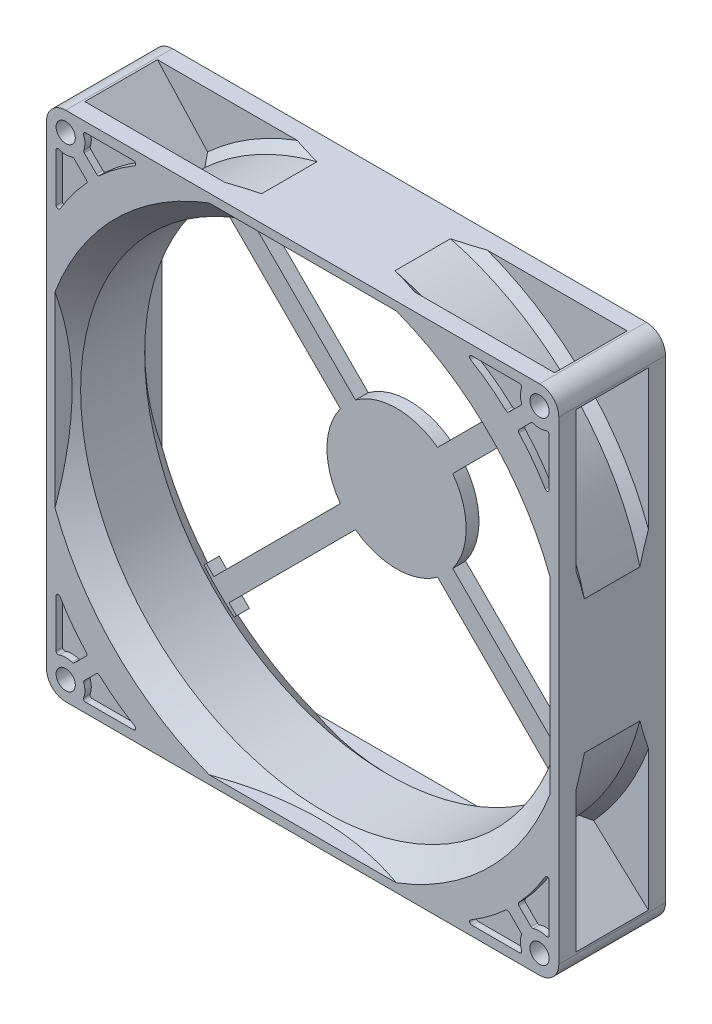
from build123d import *

# Parameters (mm, degrees)
SKETCH1_R                    = 2.25
BOSS_EXTRUDE1_DEPTH          = 12.5
CUT_EXTRUDE1_DEPTH           = 1.5
SPLIT1_SURFACE_1_BACK        = 172.537
SPLIT1_SURFACE_1_DEPTH       = 345.074
SPLIT1_SURFACE_2_BACK        = 172.537
SPLIT1_SURFACE_2_DEPTH       = 345.074
SKETCH6_R                    = 57
CUT_EXTRUDE2_DEPTH           = 25
CHAMFER1_SIZE                = 5
SKETCH7_R                    = 3.4
CUT_EXTRUDE3_DEPTH           = 2.5
BOSS_EXTRUDE2_DEPTH          = 3
CUT_EXTRUDE4_DEPTH           = 8.5
CHAMFER2_SIZE                = 2
CIRPATTERN1_COUNT            = 4
CHAMFER2_OF_CIRPATTERN1_SIZE = 2


with BuildPart() as part:
    # Sketch1 → Boss-Extrude1 (new, symmetric)
    with BuildSketch(Plane.XY):
        with BuildLine():
            Line((-55.5, -60), (55.5, -60))
            ThreePointArc((55.5, -60), (58.681980515, -58.681980515), (60, -55.5))
            Line((60, -55.5), (60, 55.5))
            ThreePointArc((60, 55.5), (58.681980515, 58.681980515), (55.5, 60))
            Line((55.5, 60), (-55.5, 60))
            ThreePointArc((-55.5, 60), (-58.681980515, 58.681980515), (-60, 55.5))
            Line((-60, 55.5), (-60, -55.5))
            ThreePointArc((-60, -55.5), (-58.681980515, -58.681980515), (-55.5, -60))
        make_face()
        with Locations((-55.5, 55.5)):
            Circle(SKETCH1_R, mode=Mode.SUBTRACT)
        with Locations((-55.5, -55.5)):
            Circle(SKETCH1_R, mode=Mode.SUBTRACT)
        with Locations((55.5, -55.5)):
            Circle(SKETCH1_R, mode=Mode.SUBTRACT)
        with Locations((55.5, 55.5)):
            Circle(SKETCH1_R, mode=Mode.SUBTRACT)
    extrude(amount=BOSS_EXTRUDE1_DEPTH, both=True)

    # Sketch3 → Cut-Extrude1 (cut)
    with BuildSketch(Plane.XY.offset(12.5)):
        with BuildLine():
            Line((-39.602885683, -57.75), (-50.816251501, -57.75))
            ThreePointArc((-50.816251501, -57.75), (-51.227043419, -57.535043856), (-51.284626351, -57.075))
            ThreePointArc((-51.284626351, -57.075), (-51.000273088, -55.549575377), (-51.250948923, -54.018256113))
            ThreePointArc((-51.250948923, -54.018256113), (-51.266226764, -53.742054123), (-51.132321003, -53.5))
            Line((-51.132321003, -53.5), (-48.302670537, -50.671382096))
            ThreePointArc((-48.302670537, -50.671382096), (-47.958934821, -50.525095133), (-47.609754736, -50.657863302))
            ThreePointArc((-47.609754736, -50.657863302), (-43.641231653, -53.95676143), (-39.347764767, -56.819984514))
            ThreePointArc((-39.347764767, -56.819984514), (-39.12069913, -57.382272932), (-39.602885683, -57.75))
        make_face()
        with BuildLine():
            Line((-48.302670537, 50.671382096), (-51.132321003, 53.5))
            ThreePointArc((-51.132321003, 53.5), (-51.266226764, 53.742054123), (-51.250948923, 54.018256113))
            ThreePointArc((-51.250948923, 54.018256113), (-51.000273088, 55.549575377), (-51.284626351, 57.075))
            ThreePointArc((-51.284626351, 57.075), (-51.227043419, 57.535043856), (-50.816251501, 57.75))
            Line((-50.816251501, 57.75), (-39.602885683, 57.75))
            ThreePointArc((-39.602885683, 57.75), (-39.12069913, 57.382272932), (-39.347764767, 56.819984514))
            ThreePointArc((-39.347764767, 56.819984514), (-43.641231653, 53.95676143), (-47.609754736, 50.657863302))
            ThreePointArc((-47.609754736, 50.657863302), (-47.958934821, 50.525095133), (-48.302670537, 50.671382096))
        make_face()
        with BuildLine():
            Line((39.602885683, 57.75), (50.816251501, 57.75))
            ThreePointArc((50.816251501, 57.75), (51.227043419, 57.535043856), (51.284626351, 57.075))
            ThreePointArc((51.284626351, 57.075), (51.000273088, 55.549575377), (51.250948923, 54.018256113))
            ThreePointArc((51.250948923, 54.018256113), (51.266226764, 53.742054123), (51.132321003, 53.5))
            Line((51.132321003, 53.5), (48.302670537, 50.671382096))
            ThreePointArc((48.302670537, 50.671382096), (47.958934821, 50.525095133), (47.609754736, 50.657863302))
            ThreePointArc((47.609754736, 50.657863302), (43.641231653, 53.95676143), (39.347764767, 56.819984514))
            ThreePointArc((39.347764767, 56.819984514), (39.12069913, 57.382272932), (39.602885683, 57.75))
        make_face()
        with BuildLine():
            Line((48.302670537, -50.671382096), (51.132321003, -53.5))
            ThreePointArc((51.132321003, -53.5), (51.266226764, -53.742054123), (51.250948923, -54.018256113))
            ThreePointArc((51.250948923, -54.018256113), (51.000273088, -55.549575377), (51.284626351, -57.075))
            ThreePointArc((51.284626351, -57.075), (51.227043419, -57.535043856), (50.816251501, -57.75))
            Line((50.816251501, -57.75), (39.602885683, -57.75))
            ThreePointArc((39.602885683, -57.75), (39.12069913, -57.382272932), (39.347764767, -56.819984514))
            ThreePointArc((39.347764767, -56.819984514), (43.641231653, -53.95676143), (47.609754736, -50.657863302))
            ThreePointArc((47.609754736, -50.657863302), (47.958934821, -50.525095133), (48.302670537, -50.671382096))
        make_face()
        with BuildLine():
            Line((-50.671382096, -48.302670537), (-53.5, -51.132321003))
            ThreePointArc((-53.5, -51.132321003), (-53.742054123, -51.266226764), (-54.018256113, -51.250948923))
            ThreePointArc((-54.018256113, -51.250948923), (-55.549575377, -51.000273088), (-57.075, -51.284626351))
            ThreePointArc((-57.075, -51.284626351), (-57.535043856, -51.227043419), (-57.75, -50.816251501))
            Line((-57.75, -50.816251501), (-57.75, -39.602885683))
            ThreePointArc((-57.75, -39.602885683), (-57.382272932, -39.12069913), (-56.819984514, -39.347764767))
            ThreePointArc((-56.819984514, -39.347764767), (-53.95676143, -43.641231653), (-50.657863302, -47.609754736))
            ThreePointArc((-50.657863302, -47.609754736), (-50.525095133, -47.958934821), (-50.671382096, -48.302670537))
        make_face()
        with BuildLine():
            Line((-50.671382096, 48.302670537), (-53.5, 51.132321003))
            ThreePointArc((-53.5, 51.132321003), (-53.742054123, 51.266226764), (-54.018256113, 51.250948923))
            ThreePointArc((-54.018256113, 51.250948923), (-55.549575377, 51.000273088), (-57.075, 51.284626351))
            ThreePointArc((-57.075, 51.284626351), (-57.535043856, 51.227043419), (-57.75, 50.816251501))
            Line((-57.75, 50.816251501), (-57.75, 39.602885683))
            ThreePointArc((-57.75, 39.602885683), (-57.382272932, 39.12069913), (-56.819984514, 39.347764767))
            ThreePointArc((-56.819984514, 39.347764767), (-53.95676143, 43.641231653), (-50.657863302, 47.609754736))
            ThreePointArc((-50.657863302, 47.609754736), (-50.525095133, 47.958934821), (-50.671382096, 48.302670537))
        make_face()
        with BuildLine():
            Line((57.75, 39.602885683), (57.75, 50.816251501))
            ThreePointArc((57.75, 50.816251501), (57.535043856, 51.227043419), (57.075, 51.284626351))
            ThreePointArc((57.075, 51.284626351), (55.549575377, 51.000273088), (54.018256113, 51.250948923))
            ThreePointArc((54.018256113, 51.250948923), (53.742054123, 51.266226764), (53.5, 51.132321003))
            Line((53.5, 51.132321003), (50.671382096, 48.302670537))
            ThreePointArc((50.671382096, 48.302670537), (50.525095133, 47.958934821), (50.657863302, 47.609754736))
            ThreePointArc((50.657863302, 47.609754736), (53.95676143, 43.641231653), (56.819984514, 39.347764767))
            ThreePointArc((56.819984514, 39.347764767), (57.382272932, 39.12069913), (57.75, 39.602885683))
        make_face()
        with BuildLine():
            Line((57.75, -39.602885683), (57.75, -50.816251501))
            ThreePointArc((57.75, -50.816251501), (57.535043856, -51.227043419), (57.075, -51.284626351))
            ThreePointArc((57.075, -51.284626351), (55.549575377, -51.000273088), (54.018256113, -51.250948923))
            ThreePointArc((54.018256113, -51.250948923), (53.742054123, -51.266226764), (53.5, -51.132321003))
            Line((53.5, -51.132321003), (50.671382096, -48.302670537))
            ThreePointArc((50.671382096, -48.302670537), (50.525095133, -47.958934821), (50.657863302, -47.609754736))
            ThreePointArc((50.657863302, -47.609754736), (53.95676143, -43.641231653), (56.819984514, -39.347764767))
            ThreePointArc((56.819984514, -39.347764767), (57.382272932, -39.12069913), (57.75, -39.602885683))
        make_face()
    cut_extrude1 = extrude(amount=-CUT_EXTRUDE1_DEPTH, mode=Mode.SUBTRACT)

    # Mirror1: Cut-Extrude1 across plane
    add(cut_extrude1.mirror(Plane.XY), mode=Mode.SUBTRACT)


with BuildPart() as body_2:
    # Split1: the piece behind the surface
    add(part.part)
    # Split1 surface: a surface, the sketch's curves swept straight by 345.074 mm
    with BuildLine(Plane.XY.offset(12.5).offset(-SPLIT1_SURFACE_1_BACK), mode=Mode.PRIVATE) as split1_surface_1_path:
        Line((-58, -58), (58, -58))
        Line((58, -58), (58, 58))
        Line((58, 58), (-58, 58))
        Line((-58, 58), (-58, -58))
    split1_surface_1 = Shell.extrude(split1_surface_1_path.wire(), (0 * SPLIT1_SURFACE_1_DEPTH, 0 * SPLIT1_SURFACE_1_DEPTH, 1 * SPLIT1_SURFACE_1_DEPTH))
    split(bisect_by=split1_surface_1, keep=Keep.BOTTOM)


with BuildPart() as part_1:
    add(part.part)

    # Split1: split by a surface, the side it looks to stays
    # Split1 surface: a surface, the sketch's curves swept straight by 345.074 mm
    with BuildLine(Plane.XY.offset(12.5).offset(-SPLIT1_SURFACE_2_BACK), mode=Mode.PRIVATE) as split1_surface_2_path:
        Line((-58, -58), (58, -58))
        Line((58, -58), (58, 58))
        Line((58, 58), (-58, 58))
        Line((-58, 58), (-58, -58))
    split1_surface_2 = Shell.extrude(split1_surface_2_path.wire(), (0 * SPLIT1_SURFACE_2_DEPTH, 0 * SPLIT1_SURFACE_2_DEPTH, 1 * SPLIT1_SURFACE_2_DEPTH))
    split(bisect_by=split1_surface_2, keep=Keep.TOP)

    # Sketch6 → Cut-Extrude2 (cut)
    with BuildSketch(Plane.XY.offset(12.5)):
        Circle(SKETCH6_R)
    extrude(amount=-CUT_EXTRUDE2_DEPTH, mode=Mode.SUBTRACT)

    # Chamfer1
    # the kernel refuses this chamfer: 5 mm, written as the material it takes off along each edge
    with BuildSketch(Plane(origin=(0, 0, -12.5), x_dir=(1, 0, 0), z_dir=(0, -1, 0))) as chamfer1_piece_1:
        Polygon((57 + CHAMFER1_SIZE, 0), (57, CHAMFER1_SIZE), (57, 0), align=None)
    revolve(axis=Axis((0, 0, -12.5), (0, 0, 1)), mode=Mode.SUBTRACT)
    with BuildSketch(Plane(origin=(0, 0, 12.5), x_dir=(1, 0, 0), z_dir=(0, -1, 0))) as chamfer1_piece_2:
        Polygon((57, -CHAMFER1_SIZE), (57 + CHAMFER1_SIZE, 0), (57, 0), align=None)
    revolve(axis=Axis((0, 0, 12.5), (0, 0, 1)), mode=Mode.SUBTRACT)


with BuildPart() as cut_extrude3_tool:
    # Sketch7 → Cut-Extrude3 (new body)
    with BuildSketch(Plane(origin=(0, 0, -12.5), x_dir=(-1, 0, 0), z_dir=(0, 0, -1))):
        with Locations((-55.5, 55.5)):
            Circle(SKETCH7_R)
        with Locations((-55.5, -55.5)):
            Circle(SKETCH7_R)
        with Locations((55.5, 55.5)):
            Circle(SKETCH7_R)
        with Locations((55.5, -55.5)):
            Circle(SKETCH7_R)
    extrude(amount=-CUT_EXTRUDE3_DEPTH)


with BuildPart() as part_2:
    add(part_1.part)

    # Cut-Extrude3: cut by cut_extrude3_tool
    add(cut_extrude3_tool.part, mode=Mode.SUBTRACT)


with BuildPart() as body_2_1:
    add(body_2.part)

    # Cut-Extrude3: cut by cut_extrude3_tool
    add(cut_extrude3_tool.part, mode=Mode.SUBTRACT)


with BuildPart() as part_3:
    add(part_2.part)

    # Combine1: union body 2
    add(body_2_1.part)

    # Sketch10 → Cut-Extrude4 (cut, symmetric)
    with BuildSketch(Plane.XY):
        with BuildLine():
            Line((41.900369192, -45.698567391), (55.013150195, -60))
            Line((55.013150195, -60), (15.620499352, -60))
            ThreePointArc((15.620499352, -60), (29.636047699, -54.458283822), (41.900369192, -45.698567391))
        make_face()
        with BuildLine():
            Line((-15.620499352, -60), (-55.013150195, -60))
            Line((-55.013150195, -60), (-41.900369192, -45.698567391))
            ThreePointArc((-41.900369192, -45.698567391), (-29.636047699, -54.458283822), (-15.620499352, -60))
        make_face()
    cut_extrude4 = extrude(amount=CUT_EXTRUDE4_DEPTH, both=True, mode=Mode.SUBTRACT)

    # Chamfer2
    chamfer2_edges = [part_3.edges().sort_by_distance(p)[0] for p in [
        (29.636047699, -54.458283822, -8.5),
        (29.636047699, -54.458283822, 8.5),
        (-29.636047699, -54.458283822, -8.5),
        (-29.636047699, -54.458283822, 8.5),
    ]]
    chamfer(chamfer2_edges, length=CHAMFER2_SIZE)

    # CirPattern1: Cut-Extrude4 ×4 about axis
    cirpattern1_axis = Axis((0, 0, 7.5), (0, 0, -1))
    for i in range(1, CIRPATTERN1_COUNT):
        add(cut_extrude4.rotate(cirpattern1_axis, i * 360 / CIRPATTERN1_COUNT), mode=Mode.SUBTRACT)

    # Chamfer2 of CirPattern1
    chamfer2_of_cirpattern1_edges = [part_3.edges().sort_by_distance(p)[0] for p in [
        (-54.458283822, -29.636047699, -8.5),
        (-54.458283822, -29.636047699, 8.5),
        (-54.458283822, 29.636047699, -8.5),
        (-54.458283822, 29.636047699, 8.5),
        (-29.636047699, 54.458283822, -8.5),
        (-29.636047699, 54.458283822, 8.5),
        (29.636047699, 54.458283822, -8.5),
        (29.636047699, 54.458283822, 8.5),
        (54.458283822, 29.636047699, -8.5),
        (54.458283822, 29.636047699, 8.5),
        (54.458283822, -29.636047699, -8.5),
        (54.458283822, -29.636047699, 8.5),
    ]]
    chamfer(chamfer2_of_cirpattern1_edges, length=CHAMFER2_OF_CIRPATTERN1_SIZE)


with BuildPart() as body_2_2:
    # Sketch8 → Boss-Extrude2 (new body)
    with BuildSketch(Plane(origin=(0, 0, -12.5), x_dir=(-1, 0, 0), z_dir=(0, 0, -1))):
        with BuildLine():
            Line((-42.778587217, 39.243053311), (-13.157235773, 9.621701867))
            ThreePointArc((-13.157235773, 9.621701867), (-16.3, 0), (-13.157235773, -9.621701867))
            Line((-13.157235773, -9.621701867), (-42.778587217, -39.243053311))
            Line((-42.778587217, -39.243053311), (-44.54635417, -37.475286358))
            Line((-44.54635417, -37.475286358), (-47.233359939, -40.162292127))
            ThreePointArc((-47.233359939, -40.162292127), (-43.840620434, -43.840620434), (-40.162292127, -47.233359939))
            Line((-40.162292127, -47.233359939), (-37.475286358, -44.54635417))
            Line((-37.475286358, -44.54635417), (-39.243053311, -42.778587217))
            Line((-39.243053311, -42.778587217), (-9.621701867, -13.157235773))
            ThreePointArc((-9.621701867, -13.157235773), (0, -16.3), (9.621701867, -13.157235773))
            Line((9.621701867, -13.157235773), (39.243053311, -42.778587217))
            Line((39.243053311, -42.778587217), (37.475286358, -44.54635417))
            Line((37.475286358, -44.54635417), (40.162292127, -47.233359939))
            ThreePointArc((40.162292127, -47.233359939), (43.840620434, -43.840620434), (47.233359939, -40.162292127))
            Line((47.233359939, -40.162292127), (44.54635417, -37.475286358))
            Line((44.54635417, -37.475286358), (42.778587217, -39.243053311))
            Line((42.778587217, -39.243053311), (13.157235773, -9.621701867))
            ThreePointArc((13.157235773, -9.621701867), (16.3, 0), (13.157235773, 9.621701867))
            Line((13.157235773, 9.621701867), (42.778587217, 39.243053311))
            Line((42.778587217, 39.243053311), (44.54635417, 37.475286358))
            Line((44.54635417, 37.475286358), (47.233359939, 40.162292127))
            ThreePointArc((47.233359939, 40.162292127), (43.840620434, 43.840620434), (40.162292127, 47.233359939))
            Line((40.162292127, 47.233359939), (37.475286358, 44.54635417))
            Line((37.475286358, 44.54635417), (39.243053311, 42.778587217))
            Line((39.243053311, 42.778587217), (9.621701867, 13.157235773))
            ThreePointArc((9.621701867, 13.157235773), (0, 16.3), (-9.621701867, 13.157235773))
            Line((-9.621701867, 13.157235773), (-39.243053311, 42.778587217))
            Line((-39.243053311, 42.778587217), (-37.475286358, 44.54635417))
            Line((-37.475286358, 44.54635417), (-40.162292127, 47.233359939))
            ThreePointArc((-40.162292127, 47.233359939), (-43.840620434, 43.840620434), (-47.233359939, 40.162292127))
            Line((-47.233359939, 40.162292127), (-44.54635417, 37.475286358))
            Line((-44.54635417, 37.475286358), (-42.778587217, 39.243053311))
        make_face()
    extrude(amount=-BOSS_EXTRUDE2_DEPTH)


with BuildPart() as part_4:
    add(part_3.part)

    # Combine2: union body 2 2
    add(body_2_2.part)


solid = part_4.part
